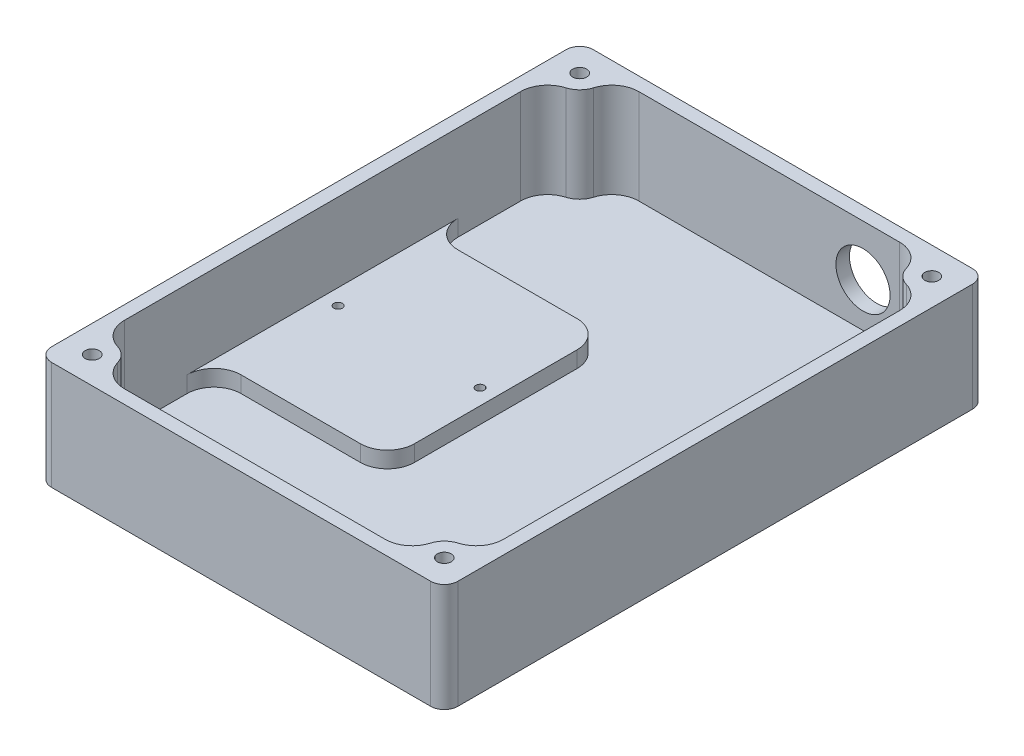
from build123d import *

# Parameters (mm, degrees)
SKETCH1_W                                      = 95.25
SKETCH1_H                                      = 127
BOSS_EXTRUDE1_DEPTH                            = 12.7
FILLET1_R                                      = 3.175
CBORE_FOR_4_SOCKET_HEAD_CAP_SCREW1_D           = 3.2639
CBORE_FOR_4_SOCKET_HEAD_CAP_SCREW1_CBORE_D     = 5.55752
CBORE_FOR_4_SOCKET_HEAD_CAP_SCREW1_CBORE_DEPTH = 2.8448
SHELL1_START                                   = -9.525
SHELL1_DEPTH                                   = 22.225
SHELL1_START_2                                 = -6.6802
SHELL1_2_DEPTH                                 = 19.3802
CUT_EXTRUDE1_START                             = -2.8448
CUT_EXTRUDE1_DEPTH                             = 2.8448
SKETCH7_W                                      = 40.64
SKETCH7_H                                      = 50.8
BOSS_EXTRUDE2_DEPTH                            = 3.81
F_3_48_TAPPED_HOLE1_D                          = 1.9939
F_3_48_TAPPED_HOLE1_DEPTH                      = 6.35
F_3_48_TAPPED_HOLE1_TIP                        = 0.599027994
FILLET4_R                                      = 6.35
FILLET5_R                                      = 6.35
SKETCH12_R                                     = 6.35
CUT_EXTRUDE2_DEPTH                             = 6.35


# Read off the part's stored shape, not the designer's step: Shell1
with BuildPart() as part:
    # Sketch1 → Boss-Extrude1 (new, symmetric)
    with BuildSketch(Plane(origin=(0, 0, 0), x_dir=(1, 0, 0), z_dir=(0, 1, 0))):
        Rectangle(SKETCH1_W, SKETCH1_H)
    extrude(amount=BOSS_EXTRUDE1_DEPTH, both=True)

    # Fillet1
    fillet1_edges = [part.edges().sort_by_distance(p)[0] for p in [
        (47.625, 0, 63.5),
        (-47.625, 0, 63.5),
        (-47.625, 0, -63.5),
        (47.625, 0, -63.5),
    ]]
    fillet(fillet1_edges, radius=FILLET1_R)

    # CBORE for #4 Socket Head Cap Screw1 (through all)
    with Locations(Plane.XZ.offset(12.7)):
        with Locations((-41.275, -57.15), (-41.275, 57.15), (41.275, 57.15), (41.275, -57.15)):
            CounterBoreHole(CBORE_FOR_4_SOCKET_HEAD_CAP_SCREW1_D / 2, CBORE_FOR_4_SOCKET_HEAD_CAP_SCREW1_CBORE_D / 2, CBORE_FOR_4_SOCKET_HEAD_CAP_SCREW1_CBORE_DEPTH)

    # Shell1 outline → Shell1 (cut)
    with BuildSketch(Plane(origin=(0, 0, 0), x_dir=(1, 0, 0), z_dir=(0, 1, 0)).offset(SHELL1_START)):
        with BuildLine():
            Line((36.238470129, 60.325), (-36.238470129, 60.325))
            ThreePointArc((-36.238470129, 60.325), (-37.06505593, 52.94005593), (-44.45, 52.113470129))
            Line((-44.45, 52.113470129), (-44.45, -52.113470129))
            ThreePointArc((-44.45, -52.113470129), (-37.06505593, -52.94005593), (-36.238470129, -60.325))
            Line((-36.238470129, -60.325), (36.238470129, -60.325))
            ThreePointArc((36.238470129, -60.325), (37.06505593, -52.94005593), (44.45, -52.113470129))
            Line((44.45, -52.113470129), (44.45, 52.113470129))
            ThreePointArc((44.45, 52.113470129), (37.06505593, 52.94005593), (36.238470129, 60.325))
        make_face()
    extrude(amount=SHELL1_DEPTH, mode=Mode.SUBTRACT)

    # Shell1 2 outline → Shell1 2 (cut)
    with BuildSketch(Plane(origin=(0, 0, 0), x_dir=(1, 0, 0), z_dir=(0, 1, 0)).offset(SHELL1_START_2)):
        with BuildLine():
            Line((-36.238470129, 60.325), (-37.665825122, 60.325))
            ThreePointArc((-37.665825122, 60.325), (-37.875973058, 53.750973058), (-44.45, 53.540825122))
            Line((-44.45, 53.540825122), (-44.45, 52.113470129))
            ThreePointArc((-44.45, 52.113470129), (-37.06505593, 52.94005593), (-36.238470129, 60.325))
        make_face()
        with BuildLine():
            Line((37.665825122, 60.325), (36.238470129, 60.325))
            ThreePointArc((36.238470129, 60.325), (37.06505593, 52.94005593), (44.45, 52.113470129))
            Line((44.45, 52.113470129), (44.45, 53.540825122))
            ThreePointArc((44.45, 53.540825122), (37.875973058, 53.750973058), (37.665825122, 60.325))
        make_face()
        with BuildLine():
            ThreePointArc((-36.238470129, -60.325), (-37.06505593, -52.94005593), (-44.45, -52.113470129))
            Line((-44.45, -52.113470129), (-44.45, -53.540825122))
            ThreePointArc((-44.45, -53.540825122), (-37.875973058, -53.750973058), (-37.665825122, -60.325))
            Line((-37.665825122, -60.325), (-36.238470129, -60.325))
        make_face()
        with BuildLine():
            Line((44.45, -53.540825122), (44.45, -52.113470129))
            ThreePointArc((44.45, -52.113470129), (37.06505593, -52.94005593), (36.238470129, -60.325))
            Line((36.238470129, -60.325), (37.665825122, -60.325))
            ThreePointArc((37.665825122, -60.325), (37.875973058, -53.750973058), (44.45, -53.540825122))
        make_face()
    extrude(amount=SHELL1_2_DEPTH, mode=Mode.SUBTRACT)

    # Sketch11 → Cut-Extrude1 (cut)
    with BuildSketch(Plane(origin=(0, -6.6802, 0), x_dir=(1, 0, 0), z_dir=(0, 1, 0)).offset(CUT_EXTRUDE1_START)):
        with BuildLine():
            Line((-44.45, 53.540825122), (-44.45, 52.113470129))
            ThreePointArc((-44.45, 52.113470129), (-37.06505593, 52.94005593), (-36.238470129, 60.325))
            Line((-36.238470129, 60.325), (-37.665825122, 60.325))
            ThreePointArc((-37.665825122, 60.325), (-37.875973058, 53.750973058), (-44.45, 53.540825122))
        make_face()
        with BuildLine():
            Line((44.45, 52.113470129), (44.45, 53.540825122))
            ThreePointArc((44.45, 53.540825122), (37.875973058, 53.750973058), (37.665825122, 60.325))
            Line((37.665825122, 60.325), (36.238470129, 60.325))
            ThreePointArc((36.238470129, 60.325), (37.06505593, 52.94005593), (44.45, 52.113470129))
        make_face()
        with BuildLine():
            Line((-44.45, -52.113470129), (-44.45, -53.540825122))
            ThreePointArc((-44.45, -53.540825122), (-37.875973058, -53.750973058), (-37.665825122, -60.325))
            Line((-37.665825122, -60.325), (-36.238470129, -60.325))
            ThreePointArc((-36.238470129, -60.325), (-37.06505593, -52.94005593), (-44.45, -52.113470129))
        make_face()
        with BuildLine():
            Line((36.238470129, -60.325), (37.665825122, -60.325))
            ThreePointArc((37.665825122, -60.325), (37.875973058, -53.750973058), (44.45, -53.540825122))
            Line((44.45, -53.540825122), (44.45, -52.113470129))
            ThreePointArc((44.45, -52.113470129), (37.06505593, -52.94005593), (36.238470129, -60.325))
        make_face()
    extrude(amount=CUT_EXTRUDE1_DEPTH, mode=Mode.SUBTRACT)

    # Sketch7 → Boss-Extrude2 (add)
    with BuildSketch(Plane(origin=(0, -9.525, 0), x_dir=(1, 0, 0), z_dir=(0, 1, 0))):
        with Locations((-24.13, 0)):
            Rectangle(SKETCH7_W, SKETCH7_H)
    extrude(amount=BOSS_EXTRUDE2_DEPTH)

    # #3-48 Tapped Hole1
    with Locations(Plane(origin=(0, -5.715, 0), x_dir=(-1, 0, 0), z_dir=(0, 1, 0))):
        with Locations((40.767, 0), (7.493, 0)):
            Hole(F_3_48_TAPPED_HOLE1_D / 2, depth=F_3_48_TAPPED_HOLE1_DEPTH)
            with Locations((0, 0, -(F_3_48_TAPPED_HOLE1_DEPTH + F_3_48_TAPPED_HOLE1_TIP / 2))):  # 118° drill point
                Cone(0, F_3_48_TAPPED_HOLE1_D / 2, F_3_48_TAPPED_HOLE1_TIP, mode=Mode.SUBTRACT)

    # Fillet4
    fillet4_edges = [part.edges().sort_by_distance(p)[0] for p in [
        (-3.81, -7.62, 25.4),
        (-3.81, -7.62, -25.4),
        (-44.45, -7.62, -25.4),
        (-44.45, -7.62, 25.4),
    ]]
    fillet(fillet4_edges, radius=FILLET4_R)

    # Fillet5
    fillet5_edges = [part.edges().sort_by_distance(p)[0] for p in [
        (37.665825122, 3.0099, -60.325),
        (44.45, 3.0099, 53.540825122),
        (-44.45, 3.0099, -53.540825122),
        (-37.665825122, 3.0099, 60.325),
        (44.45, 3.0099, -53.540825122),
        (37.665825122, 3.0099, 60.325),
        (-44.45, 3.0099, 53.540825122),
        (-37.665825122, 3.0099, -60.325),
    ]]
    fillet(fillet5_edges, radius=FILLET5_R)

    # Sketch12 → Cut-Extrude2 (cut)
    with BuildSketch(Plane(origin=(0, 0, -63.5), x_dir=(-1, 0, 0), z_dir=(0, 0, -1))):
        with Locations((-21.971, 0.762)):
            Circle(SKETCH12_R)
    extrude(amount=-CUT_EXTRUDE2_DEPTH, mode=Mode.SUBTRACT)


solid = part.part
